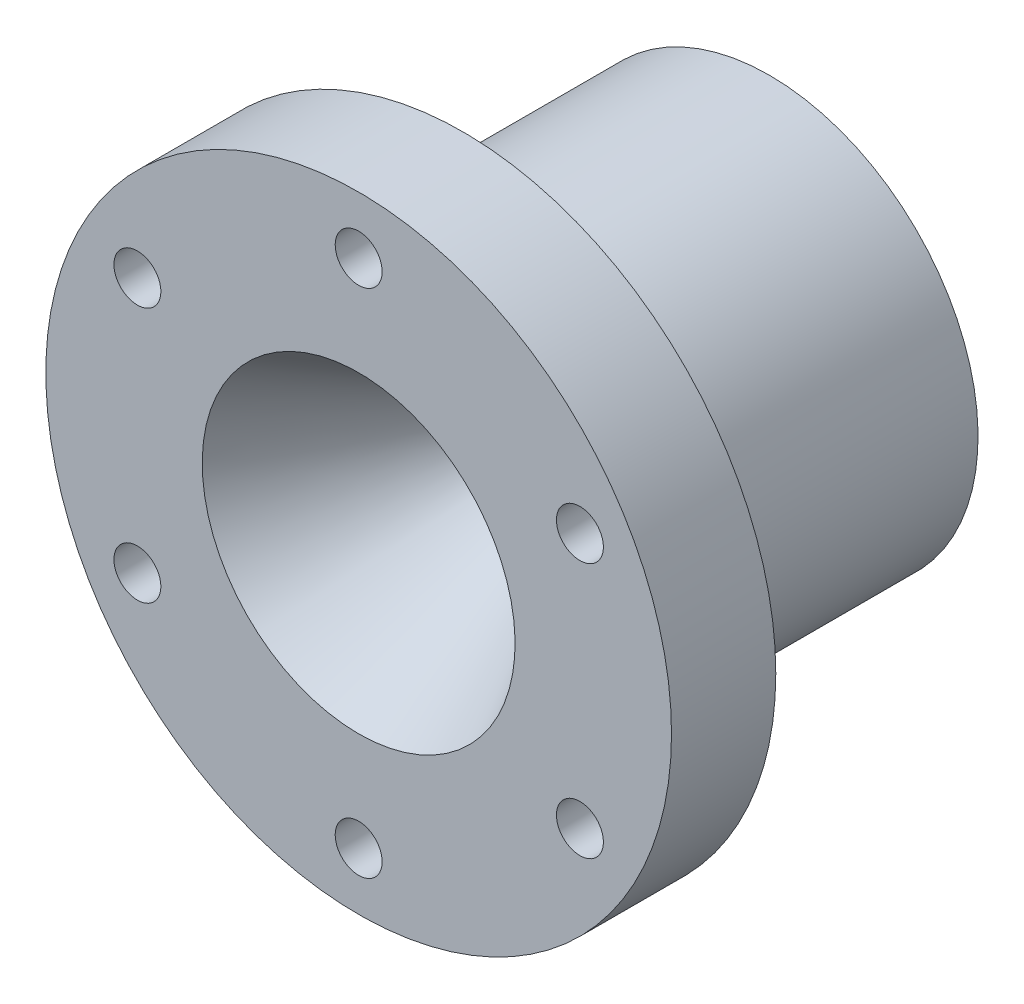
from build123d import *

# Parameters (mm, degrees)
BOSS_EXTRUDE1_START = -10
SKETCH3_R           = 30
SKETCH3_R_2         = 20
BOSS_EXTRUDE1_DEPTH = 10
CIRPATTERN1_COUNT   = 6


with BuildPart() as part:
    # Sketch2 → Revolve1 (revolve)
    with BuildSketch(Plane(origin=(0, 0, 0), x_dir=(0, 0, -1), z_dir=(1, 0, 0))):
        Polygon((21.328670365, 20), (21.328670365, 10.285), (0, 4.57), (-18.065289923, 15), (-18.065289923, 20), align=None)
    revolve(axis=Axis((0, 0, 0), (0, 0, 1)))

    # Sketch3 → Boss-Extrude1 (add)
    with BuildSketch(Plane.XY.offset(18.065289923).offset(BOSS_EXTRUDE1_START)):
        Circle(SKETCH3_R)
        Circle(SKETCH3_R_2, mode=Mode.SUBTRACT)
    extrude(amount=BOSS_EXTRUDE1_DEPTH)

    # Sketch5 → CBORE for M4 Hex Socket Head Cap Screw1 (revolve, cut)
    with BuildSketch(Plane(origin=(0, 24.5, 8.065289923), x_dir=(0, 1, 0), z_dir=(1, 0, 0))):
        Polygon((0, 0), (0, 10), (2.25, 10), (2.25, 4.4), (4, 4.4), (4, 0.025), (4.025, 0), align=None)
    cbore_for_m4_hex_socket_head_cap_screw1 = revolve(axis=Axis((0, 24.5, 1.715289923), (0, 0, 1)), mode=Mode.SUBTRACT)

    # CirPattern1: CBORE for M4 Hex Socket Head Cap Screw1 ×6 about axis
    cirpattern1_axis = Axis((0, 0, 8.065289923), (0, 0, 1))
    for i in range(1, CIRPATTERN1_COUNT):
        add(cbore_for_m4_hex_socket_head_cap_screw1.rotate(cirpattern1_axis, i * 360 / CIRPATTERN1_COUNT), mode=Mode.SUBTRACT)


solid = part.part
